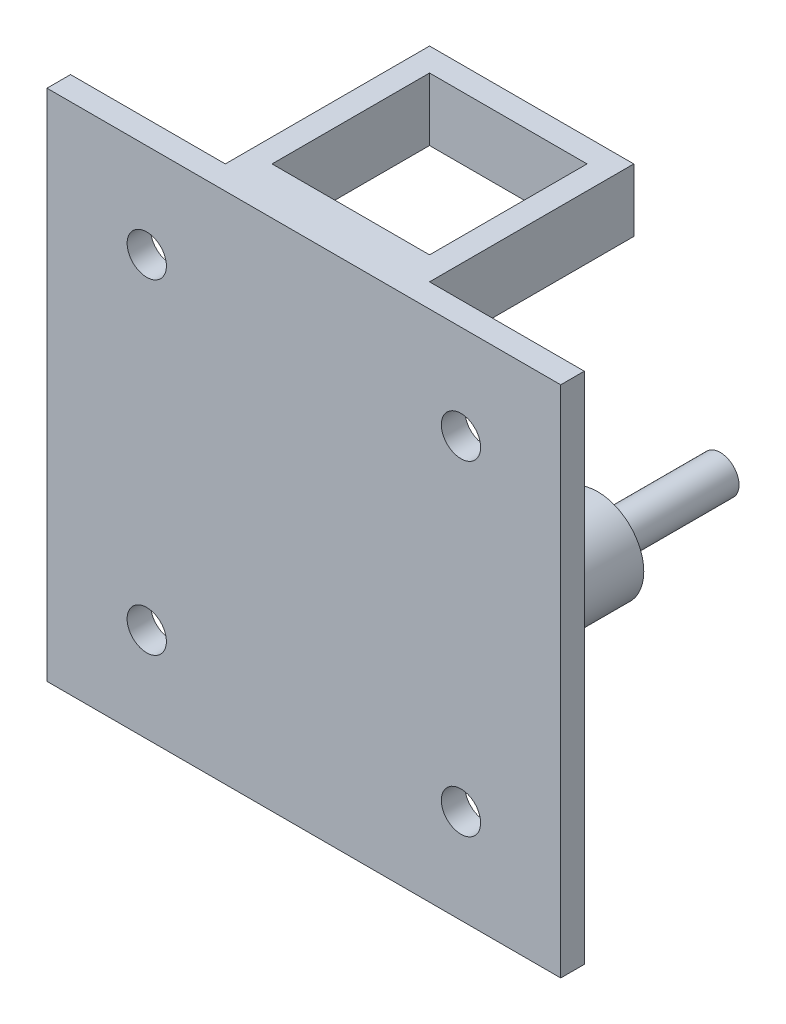
from build123d import *

# Parameters (mm, degrees)
SKETCH_1_W            = 65.4
SKETCH_1_H            = 65.4
SKETCH_1_R            = 2.5
EXTRUDE_463_DEPTH     = 3
SKETCH_2_W            = 26
SKETCH_2_H            = 8
EXTRUDE_698_DEPTH     = 26
SKETCH_3_W            = 20.05
SKETCH_3_H            = 20.05
CUT_EXTRUDE_905_DEPTH = 91.818059878
SKETCH_8_R            = 5.872551453
EXTRUDE_1_DEPTH       = 14.4
SKETCH_5_R            = 2.4
EXTRUDE_2_DEPTH       = 30
SKETCH_4_R            = 2
EXTRUDE_3_DEPTH       = 14.4
SKETCH_12_R           = 5
EXTRUDE_5_DEPTH       = 21
SKETCH_13_R           = 2
CUT_EXTRUDE_1_DEPTH   = 6.6


with BuildPart() as part:
    # Эскиз1 → Extrude 463 (new body)
    with BuildSketch(Plane.XY):
        with Locations((-32.7, 32.7)):
            Rectangle(SKETCH_1_W, SKETCH_1_H)
        with Locations((-52.7, 53.4)):
            Circle(SKETCH_1_R, mode=Mode.SUBTRACT)
        with Locations((-12.7, 53.4)):
            Circle(SKETCH_1_R, mode=Mode.SUBTRACT)
        with Locations((-12.7, 12)):
            Circle(SKETCH_1_R, mode=Mode.SUBTRACT)
        with Locations((-52.7, 12)):
            Circle(SKETCH_1_R, mode=Mode.SUBTRACT)
    extrude(amount=EXTRUDE_463_DEPTH)

    # Эскиз2 → Extrude 698 (add)
    with BuildSketch(Plane(origin=(0, 0, 0), x_dir=(-1, 0, 0), z_dir=(0, 0, -1))):
        with Locations((32.7, 61.4)):
            Rectangle(SKETCH_2_W, SKETCH_2_H)
    extrude(amount=EXTRUDE_698_DEPTH)

    # Эскиз3 → Cut-Extrude 905 (cut, through all)
    with BuildSketch(Plane.XZ.offset(-57.4)):
        with Locations((-32.7, -13)):
            Rectangle(SKETCH_3_W, SKETCH_3_H)
    extrude(amount=-CUT_EXTRUDE_905_DEPTH, mode=Mode.SUBTRACT)

    # Эскиз8 → Бобышка-Вытянуть1 (add)
    with BuildSketch(Plane(origin=(0, 0, 0), x_dir=(-1, 0, 0), z_dir=(0, 0, -1))):
        with Locations((12.7, 32.7)):
            Circle(SKETCH_8_R)
    extrude(amount=EXTRUDE_1_DEPTH)

    # Эскиз5 → Бобышка-Вытянуть2 (add)
    with BuildSketch(Plane(origin=(0, 0, 0), x_dir=(-1, 0, 0), z_dir=(0, 0, -1))):
        with Locations((12.7, 32.7)):
            Circle(SKETCH_5_R)
    extrude(amount=EXTRUDE_2_DEPTH)

    # Эскиз4 → Бобышка-Вытянуть3 (add)
    with BuildSketch(Plane(origin=(0, 0, 0), x_dir=(-1, 0, 0), z_dir=(0, 0, -1))):
        with Locations((52.7, 32.7)):
            Circle(SKETCH_4_R)
    extrude(amount=EXTRUDE_3_DEPTH)

    # Эскиз12 → Бобышка-Вытянуть5 (add)
    with BuildSketch(Plane(origin=(0, 0, 0), x_dir=(-1, 0, 0), z_dir=(0, 0, -1))):
        with Locations((52.7, 32.7)):
            Circle(SKETCH_12_R)
    extrude(amount=EXTRUDE_5_DEPTH)

    # Эскиз13 → Вырез-Вытянуть1 (cut)
    with BuildSketch(Plane(origin=(0, 0, -21), x_dir=(-1, 0, 0), z_dir=(0, 0, -1))):
        with Locations((52.7, 32.7)):
            Circle(SKETCH_13_R)
    extrude(amount=-CUT_EXTRUDE_1_DEPTH, mode=Mode.SUBTRACT)


solid = part.part
